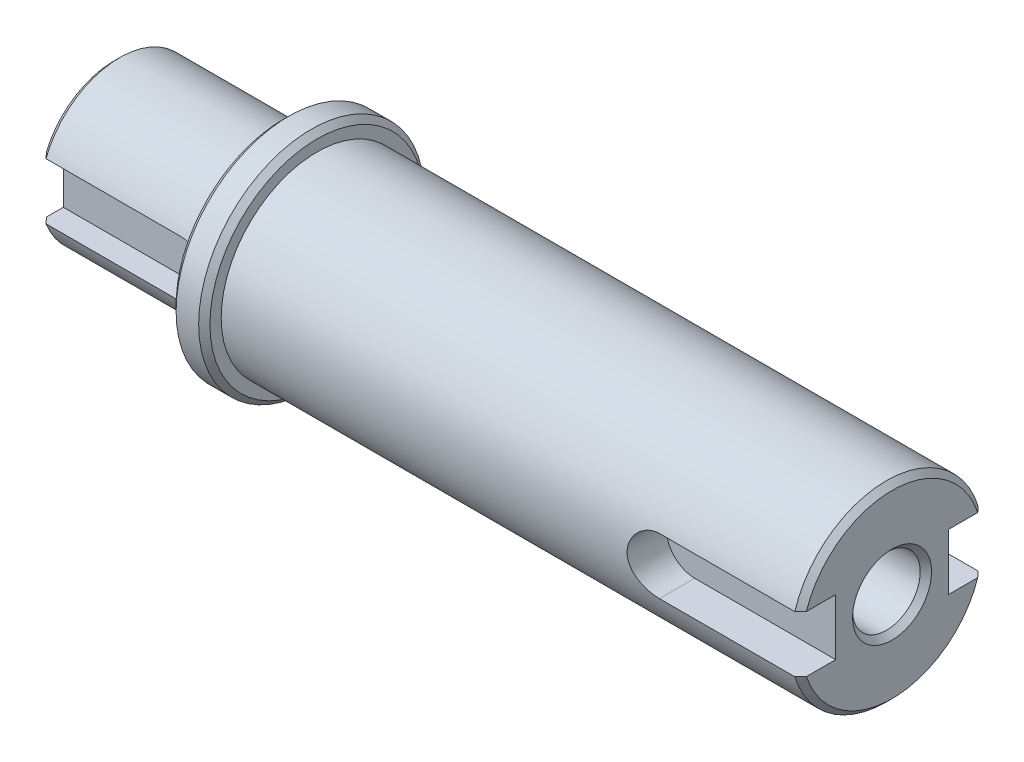
from build123d import *

# Parameters (mm, degrees)
CHAMFER_1_SIZE               = 0.5
HOLE_WIZARD_M6_1_D           = 6
HOLE_WIZARD_M6_1_DEPTH       = 15
HOLE_WIZARD_M6_1_CSINK_D     = 7
HOLE_WIZARD_M6_1_CSINK_ANGLE = 90
HOLE_WIZARD_M6_1_TIP         = 1.802581857
CUT_EXTRUDE_START            = 4.5
CUT_EXTRUDE_1_DEPTH          = 10
CUT_EXTRUDE_START_2          = 5
CUT_EXTRUDE_2_DEPTH          = 10
PATTERN_CIRCULAR_1_COUNT     = 2


with BuildPart() as part:
    # 草图1 → 旋转1 (revolve)
    with BuildSketch(Plane.XY):
        Polygon((0, 0), (0, 7), (15, 7), (15, 10), (18, 10), (18, 8.5), (69, 8.5), (69, 0), align=None)
    revolve(axis=Axis((0, 0, 0), (1, 0, 0)))

    # 倒角1
    chamfer_1_edges = [part.edges().sort_by_distance(p)[0] for p in [
        (69, -8.5, 0),
        (18, -10, 0),
        (15, -10, 0),
        (0, -7, 0),
    ]]
    chamfer(chamfer_1_edges, length=CHAMFER_1_SIZE)

    # M6 螺纹孔的螺纹孔钻头1
    with Locations(Plane(origin=(69, 0, 0), x_dir=(0, 0, -1), z_dir=(1, 0, 0))):
        with Locations((0, 0)):
            CounterSinkHole(HOLE_WIZARD_M6_1_D / 2, HOLE_WIZARD_M6_1_CSINK_D / 2, depth=HOLE_WIZARD_M6_1_DEPTH, counter_sink_angle=HOLE_WIZARD_M6_1_CSINK_ANGLE)
            with Locations((0, 0, -(HOLE_WIZARD_M6_1_DEPTH + HOLE_WIZARD_M6_1_TIP / 2))):  # 118° drill point
                Cone(0, HOLE_WIZARD_M6_1_D / 2, HOLE_WIZARD_M6_1_TIP, mode=Mode.SUBTRACT)

    # 草图4 → 切除-拉伸1 (cut)
    with BuildSketch(Plane.XY.offset(CUT_EXTRUDE_START)):
        with BuildLine():
            Line((0, 2.5), (12.5, 2.5))
            ThreePointArc((12.5, 2.5), (15, 0), (12.5, -2.5))
            Line((12.5, -2.5), (0, -2.5))
            Line((0, -2.5), (0, 2.5))
        make_face()
    extrude(amount=CUT_EXTRUDE_1_DEPTH, mode=Mode.SUBTRACT)

    # 草图5 → 切除-拉伸2 (cut)
    with BuildSketch(Plane.XY.offset(CUT_EXTRUDE_START_2)):
        with BuildLine():
            Line((69, 2.5), (56.5, 2.5))
            ThreePointArc((56.5, 2.5), (54, 0), (56.5, -2.5))
            Line((56.5, -2.5), (69, -2.5))
            Line((69, -2.5), (69, 2.5))
        make_face()
    cut_extrude_2 = extrude(amount=CUT_EXTRUDE_2_DEPTH, mode=Mode.SUBTRACT)

    # 阵列(圆周)1: 切除-拉伸2 ×2 about axis
    pattern_circular_1_axis = Axis((0, 0, 0), (-1, 0, 0))
    for i in range(1, PATTERN_CIRCULAR_1_COUNT):
        add(cut_extrude_2.rotate(pattern_circular_1_axis, i * 360 / PATTERN_CIRCULAR_1_COUNT), mode=Mode.SUBTRACT)


solid = part.part
